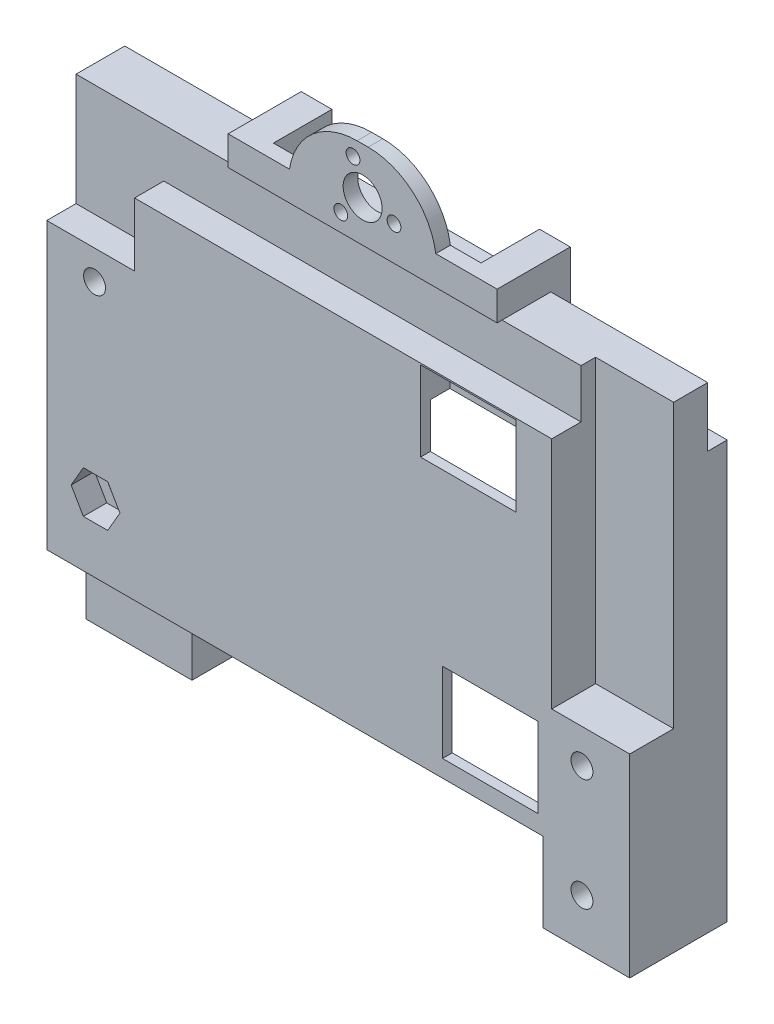
from build123d import *

# Parameters (mm, degrees)
SKETCH1_R           = 6
BOSS_EXTRUDE1_DEPTH = 6
SKETCH2_W           = 27.6
SKETCH2_H           = 16.6
SKETCH2_R           = 6
SKETCH2_R_2         = 0.705
SKETCH2_R_3         = 2
BOSS_EXTRUDE2_DEPTH = 1.5
BOSS_EXTRUDE3_START = -4
BOSS_EXTRUDE3_DEPTH = 4
SKETCH5_W           = 40
SKETCH5_H           = 38.75
CUT_EXTRUDE1_DEPTH  = 50.346876803
SKETCH6_W           = 59.8
SKETCH6_H           = 40.75
BOSS_EXTRUDE4_DEPTH = 4
SKETCH7_W           = 40
SKETCH7_H           = 38.75
CUT_EXTRUDE2_DEPTH  = 3
SKETCH8_W           = 10.5
SKETCH8_H           = 8.15
CUT_EXTRUDE3_DEPTH  = 3
SKETCH8_3_W         = 9.813424901
SKETCH8_3_H         = 8.2
CUT_EXTRUDE4_DEPTH  = 1
CUT_EXTRUDE5_DEPTH  = 2
SKETCH10_W          = 8.9
SKETCH10_H          = 8.15
BOSS_EXTRUDE5_DEPTH = 4
SKETCH12_W          = 7.5
SKETCH12_H          = 1.5
CUT_EXTRUDE7_DEPTH  = 50.346876803
CUT_EXTRUDE8_DEPTH  = 2.4
CUT_EXTRUDE9_DEPTH  = 2.4
SKETCH16_R          = 1.125
CUT_EXTRUDE10_DEPTH = 50.788193884
SKETCH17_W          = 42
SKETCH17_H          = 31
CUT_EXTRUDE11_DEPTH = 8.5
SKETCH19_W          = 21.3
SKETCH19_H          = 12.25
CUT_EXTRUDE12_DEPTH = 50.141268301
SKETCH20_W          = 3.149886021
SKETCH20_H          = 7.5
SKETCH20_W_2        = 3.150113979
CUT_EXTRUDE13_DEPTH = 50.346876803
FILLET1_R           = 7
SKETCH21_W          = 5
SKETCH21_H          = 1.4
CUT_EXTRUDE14_DEPTH = 50.141268301
SKETCH22_W          = 9.813424901
SKETCH22_H          = 3.6
CUT_EXTRUDE15_DEPTH = 2
SKETCH23_W          = 3.149886021
SKETCH23_H          = 7.5
SKETCH23_W_2        = 3.150113979
CUT_EXTRUDE16_DEPTH = 50.346876803
SKETCH24_W          = 35
SKETCH24_H          = 1.4
CUT_EXTRUDE17_DEPTH = 49.713519689


# Read off the part's stored shape, not the designer's step: Boss-Extrude3
with BuildPart() as part:
    # Sketch1 → Boss-Extrude1 (new body)
    with BuildSketch(Plane.XY):
        Polygon((-10.832250172, 36.035749909), (-10.832250172, 19.435749909), (-15.532250172, 19.435749909), (-15.532250172, -1.464250091), (-24.232250172, -1.464250091), (-24.232250172, 19.435749909), (-26.932250172, 19.435749909), (-26.932250172, -23.364250091), (32.867749828, -23.364250091), (32.867749828, 19.435749909), (30.167749828, 19.435749909), (30.167749828, -1.464250091), (21.467749828, -1.464250091), (21.467749828, 19.435749909), (16.767749828, 19.435749909), (16.767749828, 36.035749909), align=None)
        with Locations((2.967749828, 29.785749909)):
            Circle(SKETCH1_R, mode=Mode.SUBTRACT)
    extrude(amount=BOSS_EXTRUDE1_DEPTH)

    # Sketch2 → Boss-Extrude2 (add)
    # profile 1 of 2: a face of its own
    with BuildSketch(Plane.XY.offset(6)):
        with Locations((2.967749828, 27.735749909)):
            Rectangle(SKETCH2_W, SKETCH2_H)
        with Locations((2.967749828, 29.785749909)):
            Circle(SKETCH2_R, mode=Mode.SUBTRACT)
    # profile 2 of 2: a face of its own
    with BuildSketch(Plane.XY.offset(6)):
        with Locations((2.967749828, 29.785749909)):
            Circle(SKETCH2_R)
        with Locations((0.732850657, 27.357741339)):
            Circle(SKETCH2_R_2, mode=Mode.SUBTRACT)
        with Locations((6.187916827, 29.064275155)):
            Circle(SKETCH2_R_2, mode=Mode.SUBTRACT)
        with Locations((1.982482071, 32.935233827)):
            Circle(SKETCH2_R_2, mode=Mode.SUBTRACT)
        with Locations((2.967749828, 29.785749909)):
            Circle(SKETCH2_R_3, mode=Mode.SUBTRACT)
    extrude(amount=BOSS_EXTRUDE2_DEPTH)

    # Boss-Extrude3 outline → Boss-Extrude3 (add)
    with BuildSketch(Plane.XY.offset(6).offset(BOSS_EXTRUDE3_START)):
        Polygon((32.867749828, 19.435749909), (32.867749828, 25.535749909), (16.767749828, 25.535749909), (16.767749828, 19.435749909), (21.467749828, 19.435749909), (21.467749828, -1.464250091), (30.167749828, -1.464250091), (30.167749828, 19.435749909), align=None)
        Polygon((-26.932250172, 25.535749909), (-26.932250172, 19.435749909), (-24.232250172, 19.435749909), (-24.232250172, -1.464250091), (-15.532250172, -1.464250091), (-15.532250172, 19.435749909), (-10.832250172, 19.435749909), (-10.832250172, 25.535749909), align=None)
    extrude(amount=BOSS_EXTRUDE3_DEPTH)

    # Sketch5 → Cut-Extrude1 (cut, through all)
    with BuildSketch(Plane(origin=(0, 0, 0), x_dir=(-1, 0, 0), z_dir=(0, 0, -1))):
        with Locations((-3.967749828, -2.589250091)):
            Rectangle(SKETCH5_W, SKETCH5_H)
    extrude(amount=-CUT_EXTRUDE1_DEPTH, mode=Mode.SUBTRACT)

    # Sketch6 → Boss-Extrude4 (add)
    with BuildSketch(Plane.XY.offset(6)):
        with Locations((2.967749828, 5.160749909)):
            Rectangle(SKETCH6_W, SKETCH6_H)
    extrude(amount=BOSS_EXTRUDE4_DEPTH)

    # Sketch7 → Cut-Extrude2 (cut)
    with BuildSketch(Plane(origin=(0, 0, 6), x_dir=(-1, 0, 0), z_dir=(0, 0, -1))):
        with Locations((-3.967749828, -2.589250091)):
            Rectangle(SKETCH7_W, SKETCH7_H)
    extrude(amount=-CUT_EXTRUDE2_DEPTH, mode=Mode.SUBTRACT)

    # Sketch8 → Cut-Extrude3 (cut)
    with BuildSketch(Plane.XY.offset(10)):
        Polygon((24.867749828, -3.464250091), (32.867749828, -3.464250091), (32.867749828, 25.535749909), (-26.932250172, 25.535749909), (-26.932250172, 14.035749909), (-17.932250172, 14.035749909), (-17.932250172, 20.535749909), (24.867749828, 20.535749909), align=None)
        with Locations((-21.682250172, -19.289250091)):
            Rectangle(SKETCH8_W, SKETCH8_H)
    extrude(amount=-CUT_EXTRUDE3_DEPTH, mode=Mode.SUBTRACT)

    # Sketch8<3> → Cut-Extrude4 (cut)
    with BuildSketch(Plane.XY.offset(10)):
        with Locations((16.317749828, 16.285749909)):
            Rectangle(SKETCH8_3_W, SKETCH8_3_H)
        with Locations((18.567749828, -9.364250091)):
            Rectangle(SKETCH8_3_W, SKETCH8_3_H)
    extrude(amount=-CUT_EXTRUDE4_DEPTH, mode=Mode.SUBTRACT)

    # Sketch9 → Cut-Extrude5 (cut)
    with BuildSketch(Plane.XY.offset(7.5)):
        Polygon((24.867749828, 20.535749909), (24.867749828, -3.464250091), (32.867749828, -3.464250091), (32.867749828, 25.535749909), (24.867749828, 25.535749909), align=None)
    extrude(amount=-CUT_EXTRUDE5_DEPTH, mode=Mode.SUBTRACT)

    # Sketch10 → Boss-Extrude5 (add)
    with BuildSketch(Plane.XY.offset(6)):
        with Locations((28.417749828, -19.289250091)):
            Rectangle(SKETCH10_W, SKETCH10_H)
    extrude(amount=BOSS_EXTRUDE5_DEPTH)

    # Sketch12 → Cut-Extrude7 (cut, through all)
    with BuildSketch(Plane.XY.offset(7.5)):
        with Locations((-0.78247813, 35.285749909)):
            Rectangle(SKETCH12_W, SKETCH12_H)
        with Locations((6.71752187, 35.285749909)):
            Rectangle(SKETCH12_W, SKETCH12_H)
    extrude(amount=-CUT_EXTRUDE7_DEPTH, mode=Mode.SUBTRACT)

    # Sketch13 → Cut-Extrude8 (cut)
    with BuildSketch(Plane.XY.offset(10)):
        Polygon((-19.432250172, -8.214250091), (-20.682250172, -6.049186582), (-23.182250172, -6.049186582), (-24.432250172, -8.214250091), (-23.182250172, -10.379313601), (-20.682250172, -10.379313601), align=None)
    extrude(amount=-CUT_EXTRUDE8_DEPTH, mode=Mode.SUBTRACT)

    # Sketch15 → Cut-Extrude9 (cut)
    with BuildSketch(Plane(origin=(-203.37180159, 125.682543488, 5.600198), x_dir=(1, 0, 0), z_dir=(0, 0, 1))):
        Polygon((180.089551417, -116.811857089), (182.589551417, -116.811857089), (183.839551417, -114.646793579), (182.589551417, -112.48173007), (180.089551417, -112.48173007), (178.839551417, -114.646793579), align=None)
        Polygon((176.439551417, -112.48173007), (176.439551417, -116.811857089), (180.089551417, -116.811857089), (178.839551417, -114.646793579), (180.089551417, -112.48173007), align=None)
    extrude(amount=-CUT_EXTRUDE9_DEPTH, mode=Mode.SUBTRACT)

    # Sketch16 → Cut-Extrude10 (cut, through all)
    with BuildSketch(Plane.XY.offset(10)):
        with Locations((-21.932250172, -8.214250091)):
            Circle(SKETCH16_R)
        with Locations((-22.032250172, 11.035749909)):
            Circle(SKETCH16_R)
        with Locations((27.967749828, -6.964250091)):
            Circle(SKETCH16_R)
        with Locations((27.967749828, -18.464250091)):
            Circle(SKETCH16_R)
    extrude(amount=-CUT_EXTRUDE10_DEPTH, mode=Mode.SUBTRACT)

    # Sketch17 → Cut-Extrude11 (cut)
    with BuildSketch(Plane(origin=(0, 0, 0), x_dir=(-1, 0, 0), z_dir=(0, 0, -1))):
        with Locations((-2.967749828, 1.285749909)):
            Rectangle(SKETCH17_W, SKETCH17_H)
    extrude(amount=-CUT_EXTRUDE11_DEPTH, mode=Mode.SUBTRACT)

    # Sketch19 → Cut-Extrude12 (cut, through all)
    with BuildSketch(Plane(origin=(0, 0, 6), x_dir=(-1, 0, 0), z_dir=(0, 0, -1))):
        with Locations((-2.967635849, 29.910749909)):
            Rectangle(SKETCH19_W, SKETCH19_H)
    extrude(amount=CUT_EXTRUDE12_DEPTH, mode=Mode.SUBTRACT)

    # Sketch20 → Cut-Extrude13 (cut, through all)
    with BuildSketch(Plane.XY.offset(7.5)):
        with Locations((-6.107421141, 32.285749909)):
            Rectangle(SKETCH20_W, SKETCH20_H)
        with Locations((12.04257886, 32.285749909)):
            Rectangle(SKETCH20_W_2, SKETCH20_H)
    extrude(amount=-CUT_EXTRUDE13_DEPTH, mode=Mode.SUBTRACT)

    # Fillet1
    # the kernel refuses this fillet: 7 mm, written as the material it takes off along each edge
    with BuildSketch(Plane(origin=(-4.53247813, 34.535749909, 24.820508076), x_dir=(0, -1, 0), z_dir=(0, 0, -1))) as fillet1_piece_1:
        with BuildLine():
            CenterArc((7, -6.92820323), FILLET1_R, 98.213210702, 81.786789298)
            Line((0, -6.92820323), (-0.14, -6.92820323))
            Line((-0.14, -6.92820323), (-0.14, 0))
            Line((-0.14, 0), (0, 0.14))
            ThreePointArc((0, 0.14), (3, 0.14), (5.98, 0.138564065))
            Line((5.98, 0.138564065), (6, 0))
        make_face()
    extrude(amount=36.141016151, mode=Mode.SUBTRACT)
    with BuildSketch(Plane(origin=(10.46752187, 34.535749909, 24.820508076), x_dir=(-1, 0, 0), z_dir=(0, 0, -1))) as fillet1_piece_2:
        with BuildLine():
            CenterArc((6.92820323, -7), FILLET1_R, 90, 81.786789298)
            Line((0, -6), (-0.138564065, -5.98))
            ThreePointArc((-0.138564065, -5.98), (-0.14, -3), (-0.14, 0))
            Line((-0.14, 0), (0, 0.14))
            Line((0, 0.14), (6.92820323, 0.14))
            Line((6.92820323, 0.14), (6.92820323, 0))
        make_face()
    extrude(amount=36.141016151, mode=Mode.SUBTRACT)

    # Sketch21 → Cut-Extrude14 (cut, through all)
    with BuildSketch(Plane.XY.offset(6)):
        with Locations((-13.532250172, -22.664250091)):
            Rectangle(SKETCH21_W, SKETCH21_H)
    extrude(amount=-CUT_EXTRUDE14_DEPTH, mode=Mode.SUBTRACT)

    # Sketch22 → Cut-Extrude15 (cut)
    with BuildSketch(Plane.XY.offset(9)):
        with Locations((16.317749828, 18.585749909)):
            Rectangle(SKETCH22_W, SKETCH22_H)
    extrude(amount=-CUT_EXTRUDE15_DEPTH, mode=Mode.SUBTRACT)

    # Sketch23 → Cut-Extrude16 (cut, through all)
    with BuildSketch(Plane.XY.offset(7.5)):
        with Locations((-9.257307161, 32.285749909)):
            Rectangle(SKETCH23_W, SKETCH23_H)
        with Locations((15.192692839, 32.285749909)):
            Rectangle(SKETCH23_W_2, SKETCH23_H)
    extrude(amount=-CUT_EXTRUDE16_DEPTH, mode=Mode.SUBTRACT)

    # Sketch24 → Cut-Extrude17 (cut, through all)
    with BuildSketch(Plane(origin=(0, 0, 0), x_dir=(-1, 0, 0), z_dir=(0, 0, -1))):
        with Locations((-6.467749828, -22.664250091)):
            Rectangle(SKETCH24_W, SKETCH24_H)
    extrude(amount=-CUT_EXTRUDE17_DEPTH, mode=Mode.SUBTRACT)


solid = part.part
